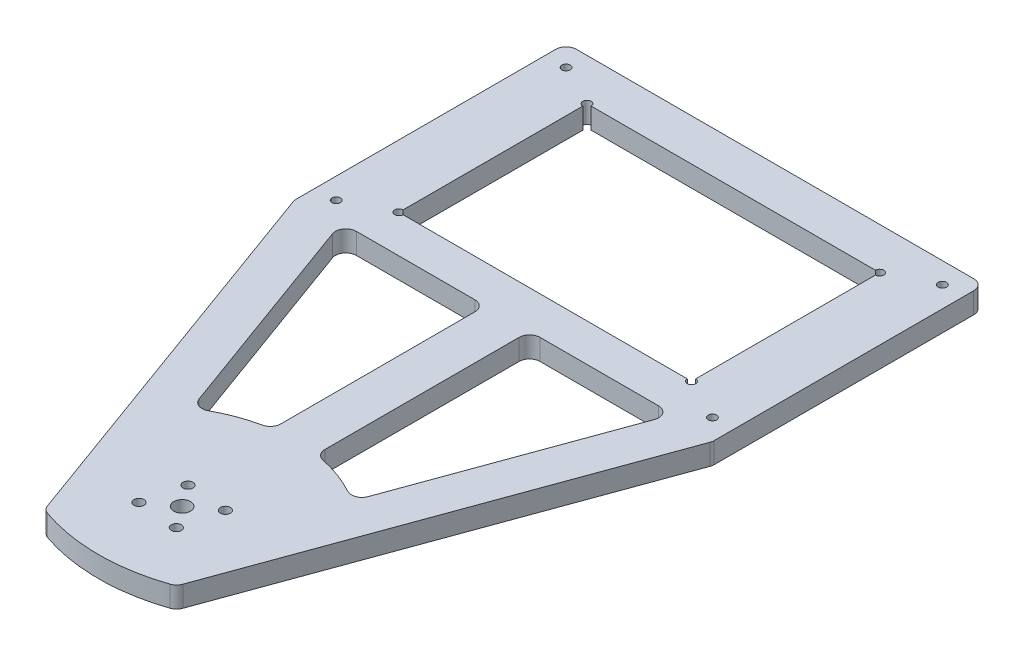
from build123d import *

# Parameters (mm, degrees)
BOSS_EXTRUDE2_DEPTH      = 6.35
CUT_EXTRUDE5_DEPTH       = 177.215191144
CUT_EXTRUDE5_DEPTH_BACK  = 177.215191144
SKETCH4_R                = 1.524
SKETCH5_R                = 1.27
CUT_EXTRUDE7_DEPTH       = 177.215191144
CUT_EXTRUDE9_DEPTH       = 177.215191144
CUT_EXTRUDE9_DEPTH_BACK  = 177.215191144
CUT_EXTRUDE10_DEPTH      = 177.215191144
CUT_EXTRUDE10_DEPTH_BACK = 177.215191144
FILLET5_R                = 3.175
CUT_EXTRUDE11_DEPTH      = 177.215191144
CUT_EXTRUDE11_DEPTH_BACK = 177.215191144
SKETCH10_R               = 2.54
FILLET9_R                = 3.175


with BuildPart() as part:
    # Sketch1 → Boss-Extrude2 (new body)
    with BuildSketch(Plane(origin=(0, 0, 0), x_dir=(1, 0, 0), z_dir=(0, 1, 0))):
        with BuildLine():
            Line((20.063441798, -160.61596284), (63.5, -41.275))
            Line((63.5, -41.275), (63.5, 41.275))
            Line((63.5, 41.275), (-63.5, 41.275))
            Line((-63.5, 41.275), (-63.5, -41.275))
            Line((-63.5, -41.275), (-20.063441798, -160.61596284))
            ThreePointArc((-20.063441798, -160.61596284), (0, -164.253526872), (20.063441798, -160.61596284))
        make_face()
    extrude(amount=BOSS_EXTRUDE2_DEPTH)

    # Sketch4 → Cut-Extrude5 (cut, two sides: drawn at the far end of the back side and taken through both)
    with BuildSketch(Plane(origin=(0, 6.35, 0), x_dir=(1, 0, 0), z_dir=(0, 1, 0)).offset(-CUT_EXTRUDE5_DEPTH_BACK)):
        with Locations((-4.702869804, -132.3805819)):
            Circle(SKETCH4_R)
        with Locations((7.603141713, -133.329521071)):
            Circle(SKETCH4_R)
        with Locations((4.702869804, -145.326471844)):
            Circle(SKETCH4_R)
        with Locations((-7.603141713, -144.377532673)):
            Circle(SKETCH4_R)
    extrude(amount=CUT_EXTRUDE5_DEPTH + CUT_EXTRUDE5_DEPTH_BACK, mode=Mode.SUBTRACT)

    # Sketch5 → Cut-Extrude7 (cut, through all)
    with BuildSketch(Plane(origin=(0, 6.35, 0), x_dir=(1, 0, 0), z_dir=(0, 1, 0))):
        with Locations((-57.15, 34.925)):
            Circle(SKETCH5_R)
        with Locations((-57.15, -34.925)):
            Circle(SKETCH5_R)
    cut_extrude7 = extrude(amount=-CUT_EXTRUDE7_DEPTH, mode=Mode.SUBTRACT)

    # Mirror2: Cut-Extrude7 across plane
    add(cut_extrude7.mirror(Plane(origin=(0, 0, 0), x_dir=(0, 0, 1), z_dir=(1, 0, 0))), mode=Mode.SUBTRACT)

    # Sketch7 → Cut-Extrude9 (cut, two sides: drawn at the far end of the back side and taken through both)
    with BuildSketch(Plane(origin=(0, 6.35, 0), x_dir=(1, 0, 0), z_dir=(0, 1, 0)).offset(-CUT_EXTRUDE9_DEPTH_BACK)):
        with BuildLine():
            ThreePointArc((-43.18, 28.575), (-45.348025612, 29.473025612), (-44.45, 27.305))
            Line((-44.45, 27.305), (-44.45, -27.305))
            ThreePointArc((-44.45, -27.305), (-45.348025612, -29.473025612), (-43.18, -28.575))
            Line((-43.18, -28.575), (43.18, -28.575))
            ThreePointArc((43.18, -28.575), (45.348025612, -29.473025612), (44.45, -27.305))
            Line((44.45, -27.305), (44.45, 27.305))
            ThreePointArc((44.45, 27.305), (45.348025612, 29.473025612), (43.18, 28.575))
            Line((43.18, 28.575), (-43.18, 28.575))
        make_face()
    extrude(amount=CUT_EXTRUDE9_DEPTH + CUT_EXTRUDE9_DEPTH_BACK, mode=Mode.SUBTRACT)

    # Sketch8 → Cut-Extrude10 (cut, two sides: drawn at the far end of the back side and taken through both)
    with BuildSketch(Plane(origin=(0, 6.35, 0), x_dir=(1, 0, 0), z_dir=(0, 1, 0)).offset(-CUT_EXTRUDE10_DEPTH_BACK)):
        with BuildLine():
            Line((-6.713310412, -40.033834499), (-50.436689588, -40.033834499))
            Line((-50.436689588, -40.033834499), (-24.374754666, -111.638412203))
            ThreePointArc((-24.374754666, -111.638412203), (-15.911990781, -107.281191655), (-6.713310412, -104.83414794))
            Line((-6.713310412, -104.83414794), (-6.713310412, -40.033834499))
        make_face()
        with BuildLine():
            Line((50.436689588, -40.033834499), (6.713310412, -40.033834499))
            Line((6.713310412, -40.033834499), (6.713310412, -104.83414794))
            ThreePointArc((6.713310412, -104.83414794), (15.911990781, -107.281191655), (24.374754666, -111.638412203))
            Line((24.374754666, -111.638412203), (50.436689588, -40.033834499))
        make_face()
    extrude(amount=CUT_EXTRUDE10_DEPTH + CUT_EXTRUDE10_DEPTH_BACK, mode=Mode.SUBTRACT)

    # Fillet5
    fillet5_edges = [part.edges().sort_by_distance(p)[0] for p in [
        (50.436689588, 3.175, 40.033834499),
        (24.374754666, 3.175, 111.638412203),
        (-6.713310412, 3.175, 104.83414794),
        (-6.713310412, 3.175, 40.033834499),
        (6.713310412, 3.175, 40.033834499),
        (6.713310412, 3.175, 104.83414794),
        (-24.374754666, 3.175, 111.638412203),
        (-50.436689588, 3.175, 40.033834499),
        (-63.5, 3.175, -41.275),
        (63.5, 3.175, -41.275),
    ]]
    fillet(fillet5_edges, radius=FILLET5_R)

    # Sketch10 → Cut-Extrude11 (cut, two sides: drawn at the far end of the back side and taken through both)
    with BuildSketch(Plane(origin=(0, 6.35, 0), x_dir=(1, 0, 0), z_dir=(0, 1, 0)).offset(-CUT_EXTRUDE11_DEPTH_BACK)):
        with Locations((0, -138.853526872)):
            Circle(SKETCH10_R)
    extrude(amount=CUT_EXTRUDE11_DEPTH + CUT_EXTRUDE11_DEPTH_BACK, mode=Mode.SUBTRACT)

    # Fillet9
    fillet9_edges = [part.edges().sort_by_distance(p)[0] for p in [
        (-63.5, 3.175, 41.275),
        (63.5, 3.175, 41.275),
        (20.063441798, 3.175, 160.61596284),
        (-20.063441798, 3.175, 160.61596284),
    ]]
    fillet(fillet9_edges, radius=FILLET9_R)


solid = part.part
